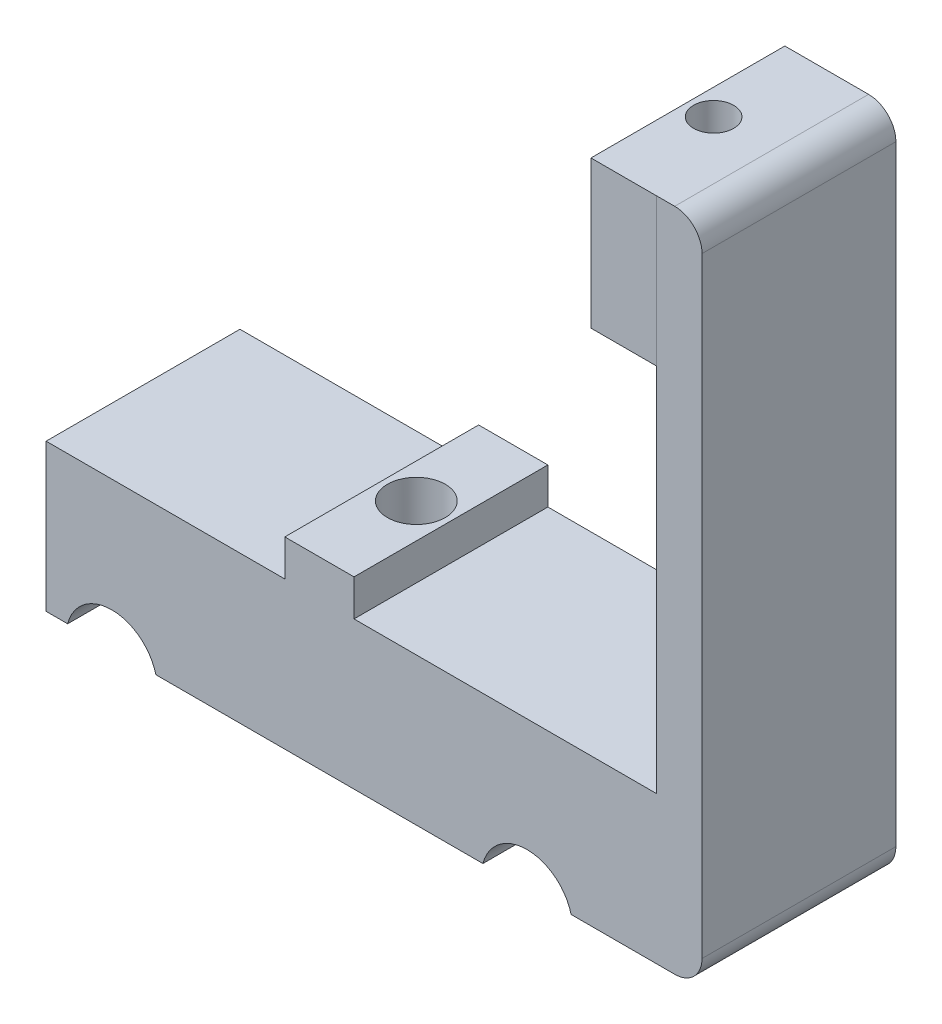
from build123d import *

# Parameters (mm, degrees)
BOSS_EXTRUDE1_DEPTH     = 10.8
BOSS_EXTRUDE2_DEPTH     = 10.64
CUT_EXTRUDE1_DEPTH      = 39.168054705
CUT_EXTRUDE1_DEPTH_BACK = 39.168054705
SKETCH5_R               = 5
FILLET1_R               = 1
SKETCH6_W               = 21.28
SKETCH6_H               = 16.18
BOSS_EXTRUDE3_DEPTH     = 12
SKETCH7_W               = 5
SKETCH7_H               = 21.281328743
BOSS_EXTRUDE4_DEPTH     = 56.83
SKETCH8_W               = 21.284331222
SKETCH8_H               = 16.18
BOSS_EXTRUDE5_DEPTH     = 7.19
FILLET3_R               = 3
SKETCH9_R               = 2.2
CUT_EXTRUDE2_DEPTH      = 85.918196519
SKETCH10_R              = 3.175
CUT_EXTRUDE3_DEPTH      = 85.918196519
SKETCH11_W              = 24.977296572
SKETCH11_H              = 9.721484234
CUT_EXTRUDE4_DEPTH      = 71.220021919


with BuildPart() as part:
    # Sketch2 → Boss-Extrude1 (new body)
    with BuildSketch(Plane.XY):
        Polygon((10.1, 0), (10.1, 1.709943763), (6.25480432, 7), (-6.25480432, 7), (-10.1, 1.709943763), (-10.1, 0), align=None)
    extrude(amount=BOSS_EXTRUDE1_DEPTH)

    # Sketch4 → Boss-Extrude2 (add, symmetric)
    with BuildSketch(Plane.XY):
        Polygon((-3.8, 0), (-3.8, -4.8), (-30, -4.8), (-30, -20.98), (30, -20.98), (30, -4.8), (3.8, -4.8), (3.8, 0), align=None)
    extrude(amount=BOSS_EXTRUDE2_DEPTH, both=True)

    # Sketch5 → Cut-Extrude1 (cut, two sides: drawn at the far end of the back side and taken through both)
    with BuildSketch(Plane.XY.offset(-CUT_EXTRUDE1_DEPTH_BACK)):
        with Locations((-22.790976064, -22.227391232)):
            Circle(SKETCH5_R)
        with Locations((22.790976064, -22.227391232)):
            Circle(SKETCH5_R)
    extrude(amount=CUT_EXTRUDE1_DEPTH + CUT_EXTRUDE1_DEPTH_BACK, mode=Mode.SUBTRACT)

    # Fillet1
    fillet1_edges = [part.edges().sort_by_distance(p)[0] for p in [
        (-10.1, 0, 5.4),
        (-10.1, 1.709943763, 5.4),
        (-6.25480432, 7, 5.4),
        (6.25480432, 7, 5.4),
        (10.1, 0, 5.4),
        (10.1, 1.709943763, 5.4),
    ]]
    fillet(fillet1_edges, radius=FILLET1_R)

    # Sketch6 → Boss-Extrude3 (add)
    with BuildSketch(Plane(origin=(30, 0, 0), x_dir=(0, 0, -1), z_dir=(1, 0, 0))):
        with Locations((0, -12.89)):
            Rectangle(SKETCH6_W, SKETCH6_H)
    extrude(amount=BOSS_EXTRUDE3_DEPTH)

    # Sketch7 → Boss-Extrude4 (add)
    with BuildSketch(Plane(origin=(0, -4.8, 0), x_dir=(1, 0, 0), z_dir=(0, 1, 0))):
        with Locations((39.5, 0.000664372)):
            Rectangle(SKETCH7_W, SKETCH7_H)
    extrude(amount=BOSS_EXTRUDE4_DEPTH)

    # Sketch8 → Boss-Extrude5 (add)
    with BuildSketch(Plane.ZY.offset(-37)):
        with Locations((0.000836868, 43.94)):
            Rectangle(SKETCH8_W, SKETCH8_H)
    extrude(amount=BOSS_EXTRUDE5_DEPTH)

    # Fillet3
    fillet3_edges = [part.edges().sort_by_distance(p)[0] for p in [
        (42, 52.03, -0.000664372),
        (42, -20.98, 0),
    ]]
    fillet(fillet3_edges, radius=FILLET3_R)

    # Sketch9 → Cut-Extrude2 (cut, through all)
    with BuildSketch(Plane.XZ.offset(20.98)):
        with Locations((32.632878078, 0)):
            Circle(SKETCH9_R)
    extrude(amount=-CUT_EXTRUDE2_DEPTH, mode=Mode.SUBTRACT)

    # Sketch10 → Cut-Extrude3 (cut, through all)
    with BuildSketch(Plane.XZ.offset(20.98)):
        with Locations((0.000925951, 0)):
            Circle(SKETCH10_R)
    extrude(amount=-CUT_EXTRUDE3_DEPTH, mode=Mode.SUBTRACT)

    # Sketch11 → Cut-Extrude4 (cut, through all)
    with BuildSketch(Plane.XY.offset(10.8)):
        with Locations((-0.121132817, 4.060742117)):
            Rectangle(SKETCH11_W, SKETCH11_H)
    extrude(amount=-CUT_EXTRUDE4_DEPTH, mode=Mode.SUBTRACT)


solid = part.part
